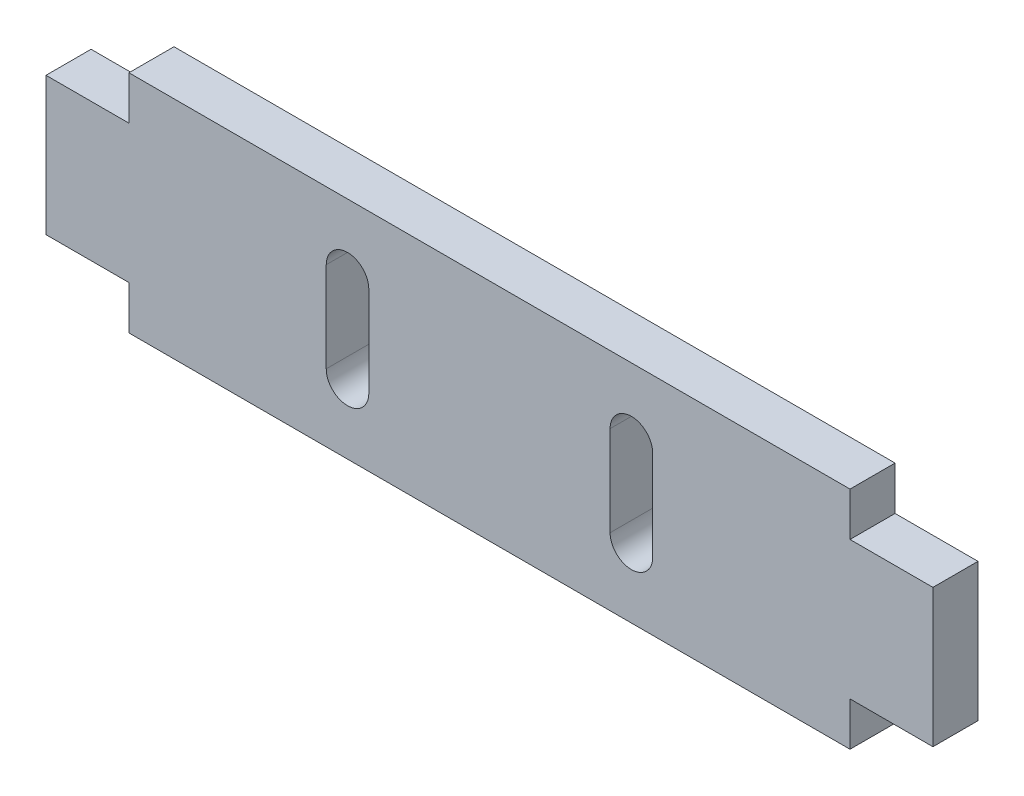
from build123d import *

# Parameters (mm, degrees)
BOSS_EXTRUDE1_DEPTH = 3.175


with BuildPart() as part:
    # Sketch1 → Boss-Extrude1 (new body)
    with BuildSketch(Plane.XY):
        Polygon((-25.4, -7.9375), (25.4, -7.9375), (25.4, -4.8625), (31.242, -4.8625), (31.242, 4.8625), (25.4, 4.8625), (25.4, 7.9375), (-25.4, 7.9375), (-25.4, 4.8625), (-31.242, 4.8625), (-31.242, -4.8625), (-25.4, -4.8625), align=None)
        with BuildLine():
            Line((-11.5, -3.175), (-11.5, 3.175))
            ThreePointArc((-11.5, 3.175), (-10, 4.675), (-8.5, 3.175))
            Line((-8.5, 3.175), (-8.5, -3.175))
            ThreePointArc((-8.5, -3.175), (-10, -4.675), (-11.5, -3.175))
        make_face(mode=Mode.SUBTRACT)
        with BuildLine():
            Line((11.5, -3.175), (11.5, 3.175))
            ThreePointArc((11.5, 3.175), (10, 4.675), (8.5, 3.175))
            Line((8.5, 3.175), (8.5, -3.175))
            ThreePointArc((8.5, -3.175), (10, -4.675), (11.5, -3.175))
        make_face(mode=Mode.SUBTRACT)
    extrude(amount=BOSS_EXTRUDE1_DEPTH)


solid = part.part
